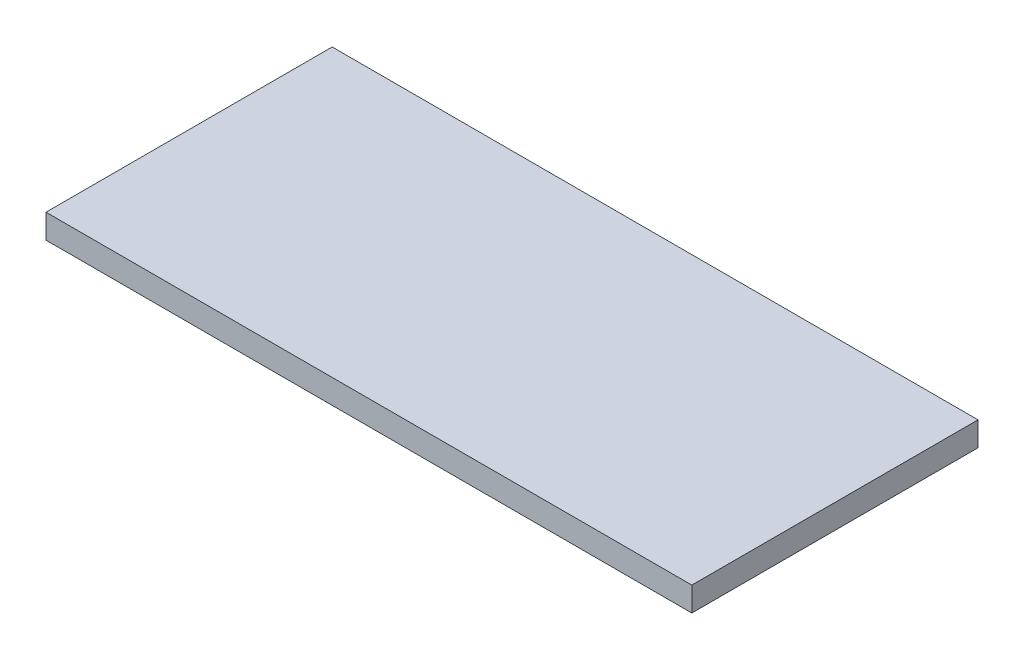
from build123d import *

# Parameters (mm, degrees)
SKETCH_1_W      = 80
SKETCH_1_H      = 35.45
EXTRUDE_1_DEPTH = 3


with BuildPart() as part:
    # 草图1 → 凸台-拉伸1 (new body)
    with BuildSketch(Plane(origin=(0, 0, 0), x_dir=(1, 0, 0), z_dir=(0, 1, 0))):
        with Locations((40, 17.725)):
            Rectangle(SKETCH_1_W, SKETCH_1_H)
    extrude(amount=EXTRUDE_1_DEPTH)


solid = part.part
